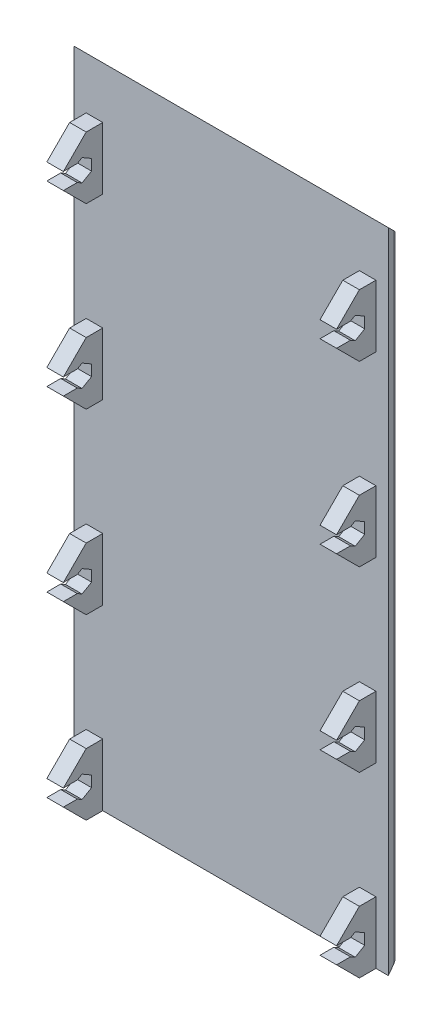
from build123d import *

# Parameters (mm, degrees)
BOSS_EXTRUDE1_DEPTH = 156.5
SKETCH4_W           = 37.518488727
SKETCH4_H           = 12.5
CUT_EXTRUDE1_DEPTH  = 173.977599706
SKETCH5_W           = 33.314858612
SKETCH5_H           = 28
CUT_EXTRUDE2_DEPTH  = 173.977599706
CUT_EXTRUDE3_DEPTH  = 170.294892232
LPATTERN1_COUNT     = 4
LPATTERN1_PITCH     = 43
CHAMFER3_SIZE       = 7
FILLET1_R           = 8
CHAMFER5_SIZE       = 6
SKETCH7_W           = 42
SKETCH7_H           = 7
CUT_EXTRUDE4_DEPTH  = 1


# Some blends are built 0.0001 mm under size
with BuildPart() as part:
    # Sketch1 → Boss-Extrude1 (new body)
    with BuildSketch(Plane(origin=(0, 0, 0), x_dir=(1, 0, 0), z_dir=(0, 1, 0))):
        Polygon((-9.215122984, 0), (-9.215122984, -10), (-5.215122984, -10), (-5.215122984, 0), (56.784877016, 0), (56.784877016, -10), (60.784877016, -10), (60.784877016, 0), (63.784877016, 0), (59.743425131, 7), (-8.1736711, 7), (-12.215122984, 0), align=None)
    extrude(amount=BOSS_EXTRUDE1_DEPTH)

    # Sketch4 → Cut-Extrude1 (cut, through all)
    with BuildSketch(Plane(origin=(60.784877016, 0, 0), x_dir=(0, 0, -1), z_dir=(1, 0, 0))):
        with Locations((-18.759244364, 150.25)):
            Rectangle(SKETCH4_W, SKETCH4_H)
    extrude(amount=-CUT_EXTRUDE1_DEPTH, mode=Mode.SUBTRACT)

    # Sketch5 → Cut-Extrude2 (cut, through all)
    with BuildSketch(Plane(origin=(60.784877016, 0, 0), x_dir=(0, 0, -1), z_dir=(1, 0, 0))):
        with Locations((-16.657429306, 115)):
            Rectangle(SKETCH5_W, SKETCH5_H)
    cut_extrude2 = extrude(amount=-CUT_EXTRUDE2_DEPTH, mode=Mode.SUBTRACT)

    # Sketch6 → Cut-Extrude3 (cut, symmetric)
    with BuildSketch(Plane(origin=(0, 0, 0), x_dir=(0, 0, -1), z_dir=(1, 0, 0))):
        Polygon((-7.3, 137.827905619), (-6.15, 138.491858429), (-10, 138.491858429), (-10, 134.508141571), (-6.15, 134.508141571), (-7.3, 135.172094381), align=None)
        Polygon((-5, 133.844188762), (-2.7, 135.172094381), (-2.7, 137.827905619), (-5, 139.155811238), (-7.3, 137.827905619), (-7.3, 135.172094381), align=None)
    cut_extrude3 = extrude(amount=CUT_EXTRUDE3_DEPTH, both=True, mode=Mode.SUBTRACT)

    # LPattern1: Cut-Extrude2, Cut-Extrude3 ×4
    with Locations(*[(0, -i * LPATTERN1_PITCH, 0) for i in range(1, LPATTERN1_COUNT)]):
        add(cut_extrude2, mode=Mode.SUBTRACT)
        add(cut_extrude3, mode=Mode.SUBTRACT)

    # Chamfer3
    chamfer3_edges = [part.edges().sort_by_distance(p)[0] for p in [
        (25.784877016, 156.5, -7),
    ]]
    chamfer(chamfer3_edges, length=CHAMFER3_SIZE - 0.0001)  # a hair under: the kernel refuses the full size

    # Fillet1
    fillet1_edges = [part.edges().sort_by_distance(p)[0] for p in [
        (-8.1736711, 74.75005, -7),
        (59.743425131, 74.75005, -7),
    ]]
    fillet(fillet1_edges, radius=FILLET1_R)

    # Chamfer5
    # the kernel refuses this chamfer: 6 mm, written as the material it takes off along each edge
    with BuildSketch(Plane(origin=(76.214974943, 43, 10), x_dir=(0, -0.027495876610586778, -0.9996219169112968), z_dir=(-1, 0, 0)), Plane(origin=(41.354779088, 144, 10), x_dir=(0, 0.027495876610586778, -0.9996219169112968), z_dir=(1, 0, 0)), Plane(origin=(76.214974943, 129, 10), x_dir=(0, -0.027495876610586778, -0.9996219169112968), z_dir=(-1, 0, 0)), Plane(origin=(-24.645220912, 144, 10), x_dir=(0, 0.027495876610586775, -0.9996219169112968), z_dir=(1, 0, 0)), Plane(origin=(10.214974943, 129, 10), x_dir=(0, -0.027495876610586778, -0.9996219169112968), z_dir=(-1, 0, 0)), Plane(origin=(-24.645220912, 101, 10), x_dir=(0, 0.027495876610586775, -0.9996219169112968), z_dir=(1, 0, 0)), Plane(origin=(10.214974943, 86, 10), x_dir=(0, -0.027495876610586778, -0.9996219169112968), z_dir=(-1, 0, 0)), Plane(origin=(41.354779088, 101, 10), x_dir=(0, 0.027495876610586778, -0.9996219169112968), z_dir=(1, 0, 0)), Plane(origin=(76.214974943, 86, 10), x_dir=(0, -0.027495876610586778, -0.9996219169112968), z_dir=(-1, 0, 0)), Plane(origin=(41.354779088, 58, 10), x_dir=(0, 0.027495876610586778, -0.9996219169112968), z_dir=(1, 0, 0)), Plane(origin=(41.354779088, 15, 10), x_dir=(0, 0.02749587661058649, -0.9996219169112968), z_dir=(1, 0, 0)), Plane(origin=(-24.645220912, 15, 10), x_dir=(0, 0.027495876610586487, -0.9996219169112968), z_dir=(1, 0, 0)), Plane(origin=(-24.645220912, 58, 10), x_dir=(0, 0.027495876610586775, -0.9996219169112968), z_dir=(1, 0, 0)), Plane(origin=(10.214974943, 43, 10), x_dir=(0, -0.027495876610586778, -0.9996219169112968), z_dir=(-1, 0, 0))) as chamfer5_piece_1:
        Polygon((CHAMFER5_SIZE * 0.999621916911, -CHAMFER5_SIZE * 0.0274958766106), (-CHAMFER5_SIZE * 0.0274958766106, -CHAMFER5_SIZE * 0.999621916911), (0, 0), align=None)
    extrude(amount=34.860195856, mode=Mode.SUBTRACT)
    with BuildSketch(Plane(origin=(41.354779088, 0, 10), x_dir=(0, -0.027495876610586372, -0.9996219169112968), z_dir=(1, 0, 0)), Plane(origin=(-24.645220912, 0, 10), x_dir=(0, -0.027495876610586372, -0.9996219169112968), z_dir=(1, 0, 0))) as chamfer5_piece_2:
        Polygon((CHAMFER5_SIZE * 0.999621916911, CHAMFER5_SIZE * 0.0274958766106), (-CHAMFER5_SIZE * 0.0274958766106, CHAMFER5_SIZE * 0.999621916911), (0, 0), align=None)
    extrude(amount=34.860195856, mode=Mode.SUBTRACT)

    # Sketch7 → Cut-Extrude4 (cut)
    with BuildSketch(Plane(origin=(0, 0, -7), x_dir=(-1, 0, 0), z_dir=(0, 0, -1))):
        with Locations((-25.784877016, 94.957259422)):
            Rectangle(SKETCH7_W, SKETCH7_H)
        Polygon((-25.784877016, 79.332903769), (-4.784877016, 91.457259422), (-18.784877016, 91.457259422), (-25.784877016, 87.415807537), (-32.784877016, 91.457259422), (-46.784877016, 91.457259422), (-32.784877016, 83.374355653), align=None)
        Polygon((-32.784877016, 75.291451884), (-25.784877016, 79.332903769), (-32.784877016, 83.374355653), (-46.784877016, 75.291451884), (-32.784877016, 67.208548116), (-25.784877016, 71.25), align=None)
        with BuildLine():
            Line((-18.784877016, 75.291451884), (-25.784877016, 71.25))
            Line((-25.784877016, 71.25), (-32.784877016, 67.208548116))
            Line((-32.784877016, 67.208548116), (-46.784877016, 59.125644347))
            Line((-46.784877016, 59.125644347), (-46.784877016, 51.042740578))
            Line((-46.784877016, 51.042740578), (-25.784877016, 63.167096231))
            Line((-25.784877016, 63.167096231), (-25.784877016, 61.542740578))
            ThreePointArc((-25.784877016, 61.542740578), (-15.284877016, 51.042740578), (-4.784877016, 61.542740578))
            Line((-4.784877016, 61.542740578), (-4.784877016, 83.374355653))
            Line((-4.784877016, 83.374355653), (-11.784877016, 79.332903769))
            Line((-11.784877016, 79.332903769), (-11.784877016, 61.542740578))
            ThreePointArc((-11.784877016, 61.542740578), (-15.284877016, 58.042740578), (-18.784877016, 61.542740578))
            Line((-18.784877016, 61.542740578), (-18.784877016, 75.291451884))
        make_face()
    extrude(amount=-CUT_EXTRUDE4_DEPTH, mode=Mode.SUBTRACT)


solid = part.part
